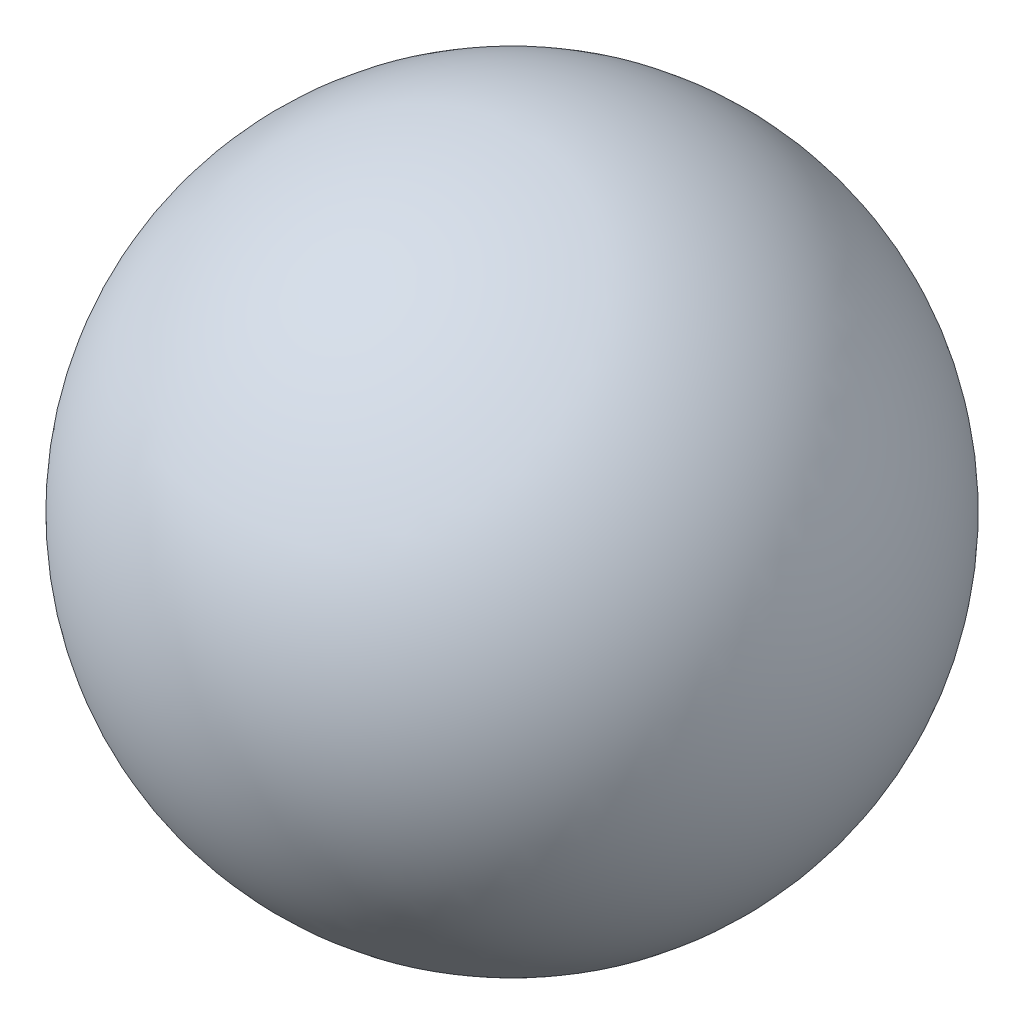
from build123d import *


with BuildPart() as part:
    # 草图1 → 旋转1 (revolve)
    with BuildSketch(Plane.XY):
        with BuildLine():
            Line((0, 108), (0, -108))
            ThreePointArc((0, -108), (108, 0), (0, 108))
        make_face()
    revolve(axis=Axis((0, 124.48740249, 0), (0, -1, 0)))


solid = part.part
